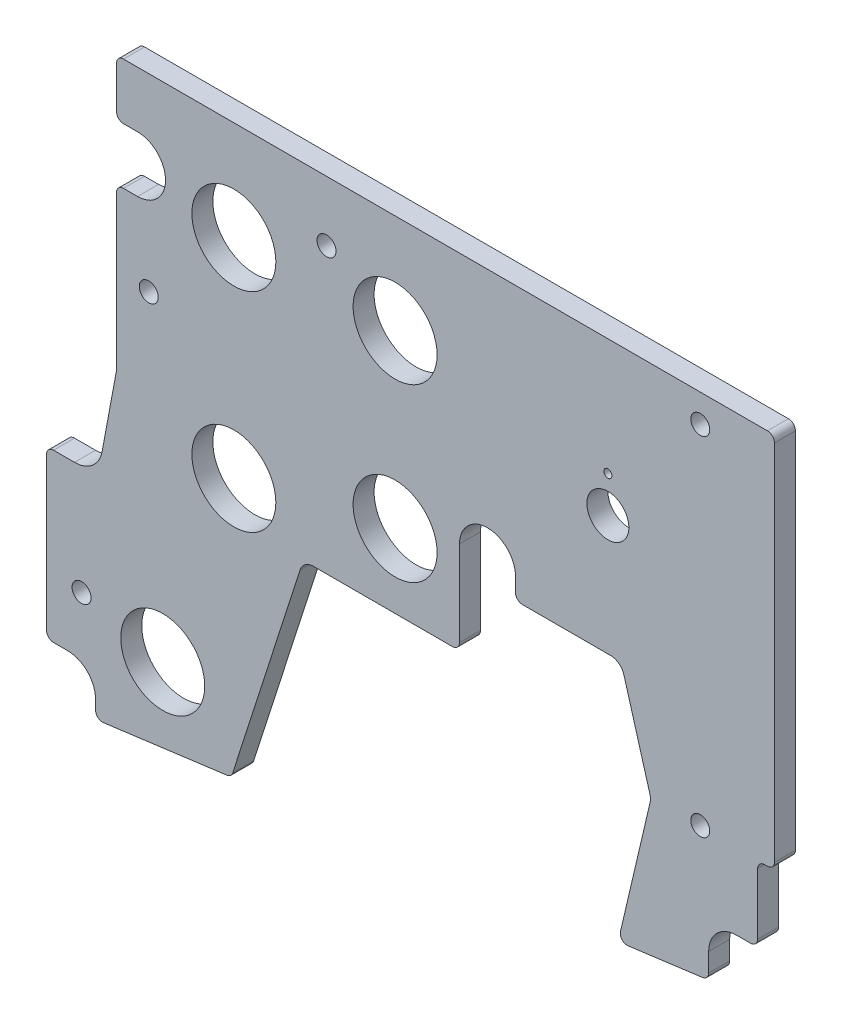
from build123d import *

# Parameters (mm, degrees)
BOSS_EXTRUDE1_DEPTH   = 4.7625
F_6_CLEARANCE_HOLE1_D = 4.3053
SKETCH5_R             = 9.525
SKETCH5_R_2           = 4.7625
CUT_EXTRUDE1_DEPTH    = 215.066671615
F_0_CLEARANCE_HOLE1_D = 1.8542


with BuildPart() as part:
    # Sketch1 → Boss-Extrude1 (new body)
    with BuildSketch(Plane.XY):
        with BuildLine():
            Line((-1.58748798, -85.534500226), (-1.587499702, -3.175000338))
            ThreePointArc((-1.587499702, -3.175000338), (-2.052467807, -2.052468316), (-3.174999928, -1.587500451))
            Line((-3.174999928, -1.587500451), (-149.225000608, -1.587521198))
            ThreePointArc((-149.225000608, -1.587521198), (-150.34753241, -2.052489195), (-150.812500382, -3.175021007))
            Line((-150.812500382, -3.175021007), (-150.812501529, -12.700020556))
            ThreePointArc((-150.812501529, -12.700020556), (-150.347533612, -13.822552695), (-149.225001529, -14.287520747))
            Line((-149.225001529, -14.287520747), (-146.049997068, -14.287520747))
            ThreePointArc((-146.049997068, -14.287520747), (-139.699997068, -20.637520747), (-146.049997068, -26.987520747))
            Line((-146.049997068, -26.987520747), (-149.225013631, -26.987520747))
            ThreePointArc((-149.225013631, -26.987520747), (-150.347545646, -27.452488732), (-150.812513631, -28.575020747))
            Line((-150.812513631, -28.575020747), (-150.812513631, -63.3538504))
            ThreePointArc((-150.812513631, -63.3538504), (-150.819200601, -63.499405937), (-150.839205177, -63.643735238))
            Line((-150.839205177, -63.643735238), (-154.094231629, -81.169566712))
            ThreePointArc((-154.094231629, -81.169566712), (-156.277952028, -84.892947063), (-160.337486649, -86.360044427))
            Line((-160.337486649, -86.360044427), (-165.099987777, -86.360045103))
            ThreePointArc((-165.099987777, -86.360045103), (-166.222519646, -86.825013168), (-166.687487552, -87.947545103))
            Line((-166.687487552, -87.947545103), (-166.687487552, -122.545535149))
            ThreePointArc((-166.687487552, -122.545535149), (-166.222519567, -123.668067164), (-165.099987552, -124.133035149))
            Line((-165.099987552, -124.133035149), (-161.924987552, -124.133035149))
            ThreePointArc((-161.924987552, -124.133035149), (-157.434859491, -125.992907088), (-155.574987552, -130.483035149))
            Line((-155.574987552, -130.483035149), (-155.574987552, -132.640440399))
            ThreePointArc((-155.574987552, -132.640440399), (-155.034199033, -133.833986093), (-153.780277221, -134.214359116))
            Line((-153.780277221, -134.214359116), (-125.771097932, -130.526880708))
            ThreePointArc((-125.771097932, -130.526880708), (-124.961326394, -130.171938663), (-124.467007026, -129.438888758))
            Line((-124.467007026, -129.438888758), (-109.180488679, -81.895646464))
            ThreePointArc((-109.180488679, -81.895646464), (-108.028045294, -80.301738907), (-106.157886207, -79.6925))
            Line((-106.157886207, -79.6925), (-74.612491751, -79.6925))
            ThreePointArc((-74.612491751, -79.6925), (-73.489959736, -79.227532015), (-73.024991751, -78.105))
            Line((-73.024991751, -78.105), (-73.024991751, -58.7375))
            ThreePointArc((-73.024991751, -58.7375), (-66.674991751, -52.3875), (-60.324991751, -58.7375))
            Line((-60.324991751, -58.7375), (-60.324991751, -61.9125))
            ThreePointArc((-60.324991751, -61.9125), (-59.860023766, -63.035032015), (-58.737491751, -63.5))
            Line((-58.737491751, -63.5), (-38.786604302, -63.5))
            ThreePointArc((-38.786604302, -63.5), (-36.87752741, -64.138062787), (-35.735764486, -65.795795009))
            Line((-35.735764486, -65.795795009), (-29.83134609, -86.284116742))
            ThreePointArc((-29.83134609, -86.284116742), (-29.708193003, -87.083358908), (-29.790944576, -87.887788459))
            Line((-29.790944576, -87.887788459), (-36.522349245, -116.610151533))
            ThreePointArc((-36.522349245, -116.610151533), (-36.153591729, -118.037818788), (-34.769518371, -118.546303629))
            Line((-34.769518371, -118.546303629), (-17.8902735, -116.324110206))
            ThreePointArc((-17.8902735, -116.324110206), (-16.903937981, -115.796902916), (-16.509983709, -114.750191247))
            Line((-16.509983709, -114.750191247), (-16.509984311, -110.516938696))
            ThreePointArc((-16.509984311, -110.516938696), (-14.655116284, -106.017688645), (-10.160000902, -104.152822935))
            Line((-10.160000902, -104.152822935), (-6.9849852, -104.152822484))
            ThreePointArc((-6.9849852, -104.152822484), (-5.862453251, -103.687854339), (-5.397485425, -102.565322258))
            Line((-5.397485425, -102.565322258), (-5.397487394, -88.709500767))
            ThreePointArc((-5.397487394, -88.709500767), (-4.932519529, -87.586968646), (-3.809987507, -87.122000541))
            Line((-3.809987507, -87.122000541), (-3.17498789, -87.122000474))
            ThreePointArc((-3.17498789, -87.122000474), (-2.052455852, -86.657032363), (-1.58748798, -85.534500226))
        make_face()
    extrude(amount=BOSS_EXTRUDE1_DEPTH)

    # #6 Clearance Hole1 (through all)
    with Locations(Plane.XY.offset(4.7625)):
        with Locations((-103.187497835, -15.240014659), (-18.414998872, -7.937503157), (-143.510001128, -44.450020387), (-158.750001128, -111.125021649), (-18.414987678, -86.741003157)):
            Hole(F_6_CLEARANCE_HOLE1_D / 2)

    # Sketch5 → Cut-Extrude1 (cut, through all)
    with BuildSketch(Plane.XY.offset(4.7625)):
        with Locations((-124.205996572, -24.130021649)):
            Circle(SKETCH5_R)
        with Locations((-87.63, -24.130021649)):
            Circle(SKETCH5_R)
        with Locations((-87.63, -62.992021649)):
            Circle(SKETCH5_R)
        with Locations((-124.205996572, -71.437521424)):
            Circle(SKETCH5_R)
        with Locations((-140.334987552, -115.57)):
            Circle(SKETCH5_R)
        with Locations((-39.36999484, -36.322003157)):
            Circle(SKETCH5_R_2)
    extrude(amount=-CUT_EXTRUDE1_DEPTH, mode=Mode.SUBTRACT)

    # #0 Clearance Hole1 (through all)
    with Locations(Plane.XY.offset(6.35)):
        with Locations((-39.36999484, -28.067003157)):
            Hole(F_0_CLEARANCE_HOLE1_D / 2)


solid = part.part
